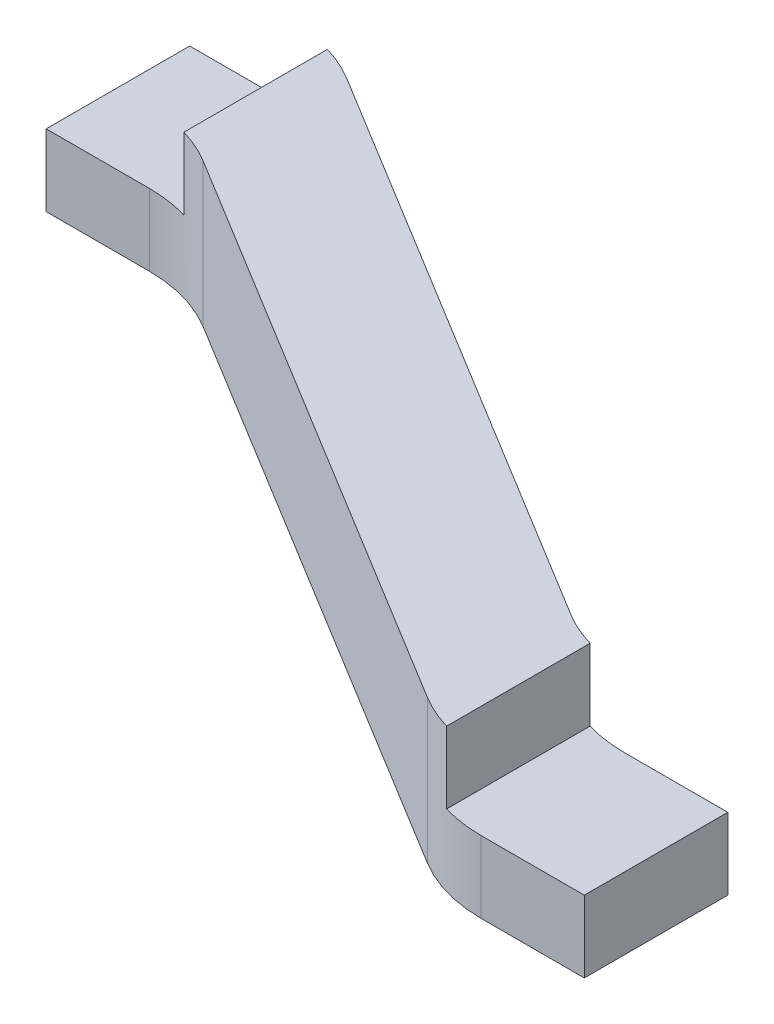
from build123d import *

# Parameters (mm, degrees)
SALIENTE_EXTRUIR1_DEPTH = 20
REDONDEO1_R             = 20
CROQUIS3_W              = 20
CROQUIS3_H              = 22.736865604
CROQUIS3_H_2            = 22.452131832
CORTAR_EXTRUIR2_DEPTH   = 10


with BuildPart() as part:
    # Croquis1 → Saliente-Extruir1 (new body)
    with BuildSketch(Plane(origin=(0, 0, 0), x_dir=(1, 0, 0), z_dir=(0, 1, 0))):
        Polygon((-65, 0), (-45, 0), (45, -55), (65, -55), (65, -75), (45, -75), (-45, -20), (-65, -20), align=None)
    extrude(amount=SALIENTE_EXTRUIR1_DEPTH)

    # Redondeo1
    redondeo1_edges = [part.edges().sort_by_distance(p)[0] for p in [
        (45, 10, 75),
        (45, 10, 55),
        (-45, 10, 0),
        (-45, 10, 20),
    ]]
    fillet(redondeo1_edges, radius=REDONDEO1_R)

    # Croquis3 → Cortar-Extruir2 (cut)
    with BuildSketch(Plane(origin=(0, 20, 0), x_dir=(1, 0, 0), z_dir=(0, 1, 0))):
        with Locations((-55, -11.368432802)):
            Rectangle(CROQUIS3_W, CROQUIS3_H)
        with Locations((55, -63.773934084)):
            Rectangle(CROQUIS3_W, CROQUIS3_H_2)
    extrude(amount=-CORTAR_EXTRUIR2_DEPTH, mode=Mode.SUBTRACT)


solid = part.part
